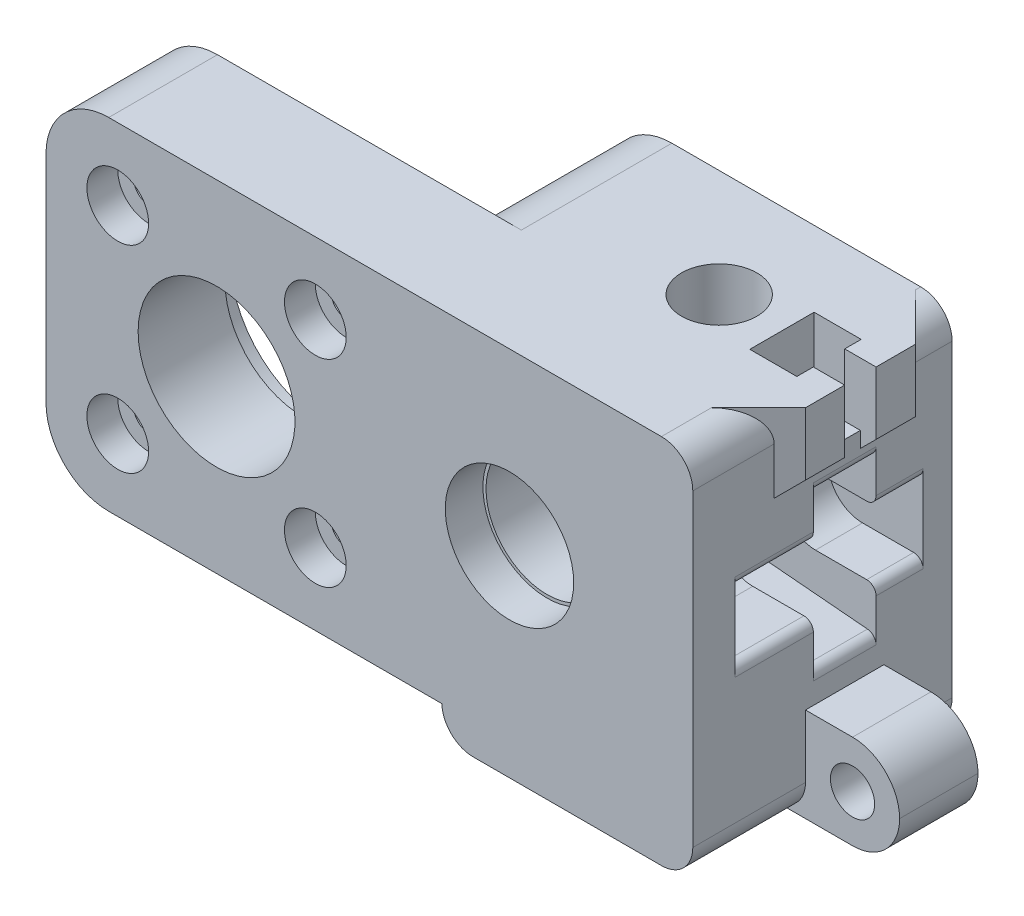
from build123d import *

# Parameters (mm, degrees)
SKETCH5_W               = 50.1536
SKETCH5_H               = 27.62
BOSS_EXTRUDE1_DEPTH     = 21
SKETCH6_R               = 5.2
CUT_EXTRUDE1_DEPTH      = 4
SKETCH7_R               = 4.95
CUT_EXTRUDE2_DEPTH      = 44.456728236
CUT_EXTRUDE3_START      = -3.048
SKETCH8_R               = 5.2
CUT_EXTRUDE3_DEPTH      = 3.048
SKETCH11_W              = 20.32
SKETCH11_H              = 6.1976
BOSS_EXTRUDE2_DEPTH     = 21
CUT_EXTRUDE4_DEPTH      = 52.113946521
CUT_EXTRUDE4_DEPTH_BACK = 52.113946521
SKETCH9_R               = 1.143
CUT_EXTRUDE5_START      = -15.2522
SKETCH12_W              = 13.208
SKETCH12_H              = 2.921
CUT_EXTRUDE5_DEPTH      = 15.2522
SKETCH13_R              = 4.9403
CUT_EXTRUDE6_DEPTH      = 8.89
SKETCH14_R              = 3.048
CUT_EXTRUDE7_DEPTH      = 6.35
CUT_EXTRUDE8_DEPTH      = 12.192
SKETCH16_R              = 7.6778
CUT_EXTRUDE9_DEPTH      = 1.778
SKETCH17_R              = 6.35
CUT_EXTRUDE10_DEPTH     = 44.23068691
SKETCH18_R              = 1.2
CUT_EXTRUDE11_DEPTH     = 43.689299066
SKETCH19_W              = 2.225
SKETCH19_H              = 21
BOSS_EXTRUDE3_DEPTH     = 23.89
SKETCH20_W              = 5.08
SKETCH20_H              = 9.90092
CUT_EXTRUDE12_DEPTH     = 46.986208701
CUT_EXTRUDE13_REACH     = 44.427
SKETCH23_W              = 8.89
SKETCH23_H              = 5.08
BOSS_EXTRUDE4_DEPTH     = 1.27
CUT_EXTRUDE15_DEPTH     = 6.35
CUT_EXTRUDE16_START     = -3.81
CUT_EXTRUDE16_DEPTH     = 3.81
SKETCH27_W              = 6.35
SKETCH27_H              = 7.62
BOSS_EXTRUDE6_DEPTH     = 7.62
CHAMFER1_SIZE           = 1.27
FILLET2_R               = 3.81
SKETCH28_W              = 3.81
SKETCH28_H              = 5.207
CUT_EXTRUDE17_DEPTH     = 5.08
SKETCH29_W              = 2.54
SKETCH29_H              = 5.08
CUT_EXTRUDE18_DEPTH     = 5.08
SKETCH30_R              = 1.7907
CUT_EXTRUDE19_DEPTH     = 43.599568856
SKETCH31_W              = 2.54
SKETCH31_H              = 1.62646495
CUT_EXTRUDE20_DEPTH     = 59.732256893
FILLET3_R               = 0.508
SKETCH32_R              = 2.5
CUT_EXTRUDE21_DEPTH     = 2.5
FILLET4_R               = 5.08
FILLET5_R               = 5.08
FILLET6_R               = 2.54
FILLET7_R               = 2.54
FILLET8_R               = 0.762
FILLET9_R               = 0.762


# Some blends are built 0.0001 mm under size
with BuildPart() as part:
    # Sketch5 → Boss-Extrude1 (new body)
    with BuildSketch(Plane.XY):
        with Locations((-12.4568, 0)):
            Rectangle(SKETCH5_W, SKETCH5_H)
    extrude(amount=BOSS_EXTRUDE1_DEPTH)

    # Sketch6 → Cut-Extrude1 (cut)
    with BuildSketch(Plane(origin=(0, 0, 0), x_dir=(-1, 0, 0), z_dir=(0, 0, -1))):
        Circle(SKETCH6_R)
    extrude(amount=-CUT_EXTRUDE1_DEPTH, mode=Mode.SUBTRACT)

    # Sketch7 → Cut-Extrude2 (cut, through all)
    with BuildSketch(Plane(origin=(0, 0, 4), x_dir=(-1, 0, 0), z_dir=(0, 0, -1))):
        Circle(SKETCH7_R)
    extrude(amount=-CUT_EXTRUDE2_DEPTH, mode=Mode.SUBTRACT)

    # Sketch8 → Cut-Extrude3 (cut)
    with BuildSketch(Plane.XY.offset(21).offset(CUT_EXTRUDE3_START)):
        with Locations(Location((0, 0, 0), (0, 0, 180))):
            Circle(SKETCH8_R)
    extrude(amount=CUT_EXTRUDE3_DEPTH, mode=Mode.SUBTRACT)

    # Sketch11 → Boss-Extrude2 (add)
    with BuildSketch(Plane(origin=(0, 0, 0), x_dir=(-1, 0, 0), z_dir=(0, 0, -1))):
        with Locations((-4.685, -13.1788)):
            Rectangle(SKETCH11_W, SKETCH11_H)
    extrude(amount=-BOSS_EXTRUDE2_DEPTH)

    # Sketch9 → Cut-Extrude4 (cut, two sides: drawn at the far end of the back side and taken through both)
    with BuildSketch(Plane.XZ.offset(13.81).offset(-CUT_EXTRUDE4_DEPTH_BACK)):
        with Locations(Location((4.685, 8.699, 0), (0, 0, 270))):
            Circle(SKETCH9_R)
    extrude(amount=CUT_EXTRUDE4_DEPTH + CUT_EXTRUDE4_DEPTH_BACK, mode=Mode.SUBTRACT)

    # Sketch12 → Cut-Extrude5 (cut)
    with BuildSketch(Plane(origin=(0, 0, 0), x_dir=(-1, 0, 0), z_dir=(0, 0, -1)).offset(CUT_EXTRUDE5_START)):
        with Locations((-4.685, -11.2738)):
            Rectangle(SKETCH12_W, SKETCH12_H)
    extrude(amount=CUT_EXTRUDE5_DEPTH, mode=Mode.SUBTRACT)

    # Sketch13 → Cut-Extrude6 (cut)
    with BuildSketch(Plane.XZ.offset(16.2776)):
        with Locations(Location((4.685, 8.699, 0), (0, 0, 270))):
            Circle(SKETCH13_R)
    extrude(amount=-CUT_EXTRUDE6_DEPTH, mode=Mode.SUBTRACT)

    # Sketch14 → Cut-Extrude7 (cut)
    with BuildSketch(Plane(origin=(0, 13.81, 0), x_dir=(1, 0, 0), z_dir=(0, 1, 0))):
        with Locations(Location((4.685, -8.699, 0), (0, 0, 180))):
            Circle(SKETCH14_R)
    extrude(amount=-CUT_EXTRUDE7_DEPTH, mode=Mode.SUBTRACT)

    # Sketch15 → Cut-Extrude8 (cut)
    with BuildSketch(Plane(origin=(0, 0, 0), x_dir=(-1, 0, 0), z_dir=(0, 0, -1))):
        Polygon((12.9286, 10.795), (12.9286, 13.81), (37.5336, 13.81), (37.5336, -13.81), (12.9286, -13.81), align=None)
    extrude(amount=-CUT_EXTRUDE8_DEPTH, mode=Mode.SUBTRACT)

    # Sketch16 → Cut-Extrude9 (cut)
    with BuildSketch(Plane(origin=(0, 0, 12.192), x_dir=(-1, 0, 0), z_dir=(0, 0, -1))):
        with Locations((23.7236, 0)):
            Circle(SKETCH16_R)
    extrude(amount=-CUT_EXTRUDE9_DEPTH, mode=Mode.SUBTRACT)

    # Sketch17 → Cut-Extrude10 (cut, through all)
    with BuildSketch(Plane(origin=(0, 0, 13.97), x_dir=(-1, 0, 0), z_dir=(0, 0, -1))):
        with Locations((23.7236, 0)):
            Circle(SKETCH17_R)
    extrude(amount=-CUT_EXTRUDE10_DEPTH, mode=Mode.SUBTRACT)

    # Sketch18 → Cut-Extrude11 (cut, through all)
    with BuildSketch(Plane(origin=(0, 0, 12.192), x_dir=(-1, 0, 0), z_dir=(0, 0, -1))):
        with Locations((15.7236, 8)):
            Circle(SKETCH18_R)
        with Locations((31.7236, 8)):
            Circle(SKETCH18_R)
        with Locations((31.7236, -8)):
            Circle(SKETCH18_R)
        with Locations((15.7236, -8)):
            Circle(SKETCH18_R)
    extrude(amount=-CUT_EXTRUDE11_DEPTH, mode=Mode.SUBTRACT)

    # Sketch19 → Boss-Extrude3 (add)
    with BuildSketch(Plane(origin=(0, -10.08, 0), x_dir=(1, 0, 0), z_dir=(0, 1, 0))):
        with Locations((13.7325, -10.5)):
            Rectangle(SKETCH19_W, SKETCH19_H)
    extrude(amount=BOSS_EXTRUDE3_DEPTH)

    # Sketch20 → Cut-Extrude12 (cut, through all)
    with BuildSketch(Plane(origin=(0, 0, 0), x_dir=(0, 0, -1), z_dir=(1, 0, 0))):
        with Locations((-8.699, 0)):
            Rectangle(SKETCH20_W, SKETCH20_H)
    extrude(amount=CUT_EXTRUDE12_DEPTH, mode=Mode.SUBTRACT)

    # Cut-Extrude13: up to this face of the body (flat: up to its plane)
    cut_extrude13_end = Plane(part.part.faces().sort_by_distance((9.310423436, 0, 6.159))[0])
    # Sketch22 → Cut-Extrude13 (cut, up to the picked face)
    with BuildSketch(Plane(origin=(0, 0, 11.239), x_dir=(-1, 0, 0), z_dir=(0, 0, -1)), mode=Mode.PRIVATE) as cut_extrude13_sk1:
        Polygon((0, 4.95046), (-17.421153116, 6.474613403), (-17.421153116, -6.474613403), (0, -4.95046), align=None)
    cut_extrude13_tool1 = split(extrude(cut_extrude13_sk1.sketch, amount=CUT_EXTRUDE13_REACH, mode=Mode.PRIVATE), bisect_by=cut_extrude13_end, keep=Keep.BOTH, mode=Mode.PRIVATE)
    add(cut_extrude13_tool1.solids().sort_by(Axis((9.097919, 0, 11.239), (0, 0, -1)))[0], mode=Mode.SUBTRACT)

    # Sketch23 → Boss-Extrude4 (add)
    with BuildSketch(Plane(origin=(14.845, 0, 0), x_dir=(0, 0, -1), z_dir=(1, 0, 0))):
        with Locations((-8.699, 11.27)):
            Rectangle(SKETCH23_W, SKETCH23_H)
    extrude(amount=BOSS_EXTRUDE4_DEPTH)

    # Sketch25 → Cut-Extrude15 (cut)
    with BuildSketch(Plane.XY.offset(11.239)):
        with BuildLine():
            Line((9.939, 2.754), (16.986034424, 2.754))
            Line((16.986034424, 2.754), (16.986034424, -2.754))
            Line((16.986034424, -2.754), (9.939, -2.754))
            ThreePointArc((9.939, -2.754), (7.185, 0), (9.939, 2.754))
        make_face()
    extrude(amount=CUT_EXTRUDE15_DEPTH, mode=Mode.SUBTRACT)

    # Sketch26 → Cut-Extrude16 (cut)
    with BuildSketch(Plane.XY.offset(6.159).offset(CUT_EXTRUDE16_START)):
        with BuildLine():
            Line((16.986034424, 2.754), (16.986034424, -2.754))
            Line((16.986034424, -2.754), (9.939, -2.754))
            ThreePointArc((9.939, -2.754), (7.185, 0), (9.939, 2.754))
            Line((9.939, 2.754), (16.986034424, 2.754))
        make_face()
    extrude(amount=CUT_EXTRUDE16_DEPTH, mode=Mode.SUBTRACT)

    # Sketch27 → Boss-Extrude6 (add)
    with BuildSketch(Plane(origin=(14.845, 0, 0), x_dir=(0, 0, -1), z_dir=(1, 0, 0))):
        with Locations((-8.699, -12.4676)):
            Rectangle(SKETCH27_W, SKETCH27_H)
    extrude(amount=BOSS_EXTRUDE6_DEPTH)

    # Chamfer1
    chamfer1_edges = [part.edges().sort_by_distance(p)[0] for p in [
        (14.845, 11.27, 13.144),
        (14.845, 11.27, 4.254),
        (14.845, 8.73, 8.699),
    ]]
    chamfer(chamfer1_edges, length=CHAMFER1_SIZE - 0.0001)  # a hair under: the kernel refuses the full size

    # Fillet2
    fillet2_edges = [part.edges().sort_by_distance(p)[0] for p in [
        (22.465, -16.2776, 8.699),
        (22.465, -8.6576, 8.699),
    ]]
    fillet(fillet2_edges, radius=FILLET2_R - 0.0001)  # a hair under: the kernel refuses the full size

    # Sketch28 → Cut-Extrude17 (cut)
    with BuildSketch(Plane(origin=(0, 13.81, 0), x_dir=(1, 0, 0), z_dir=(0, 1, 0))):
        with Locations((11.67, -8.699)):
            Rectangle(SKETCH28_W, SKETCH28_H)
    extrude(amount=-CUT_EXTRUDE17_DEPTH, mode=Mode.SUBTRACT)

    # Sketch29 → Cut-Extrude18 (cut)
    with BuildSketch(Plane.ZY.offset(-13.575)):
        with Locations((8.699, 11.27)):
            Rectangle(SKETCH29_W, SKETCH29_H)
    extrude(amount=-CUT_EXTRUDE18_DEPTH, mode=Mode.SUBTRACT)

    # Sketch30 → Cut-Extrude19 (cut, through all)
    with BuildSketch(Plane.XY.offset(11.874)):
        with Locations((18.655, -12.4676)):
            Circle(SKETCH30_R)
    extrude(amount=-CUT_EXTRUDE19_DEPTH, mode=Mode.SUBTRACT)

    # Sketch31 → Cut-Extrude20 (cut, through all)
    with BuildSketch(Plane(origin=(14.845, 0, 0), x_dir=(0, 0, -1), z_dir=(1, 0, 0))):
        with Locations((-8.699, 7.916767525)):
            Rectangle(SKETCH31_W, SKETCH31_H)
    extrude(amount=CUT_EXTRUDE20_DEPTH, mode=Mode.SUBTRACT)

    # Fillet3
    fillet3_edges = [part.edges().sort_by_distance(p)[0] for p in [
        (4.685, 7.46, 9.842),
    ]]
    fillet(fillet3_edges, radius=FILLET3_R)

    # Sketch32 → Cut-Extrude21 (cut)
    with BuildSketch(Plane.XY.offset(21)):
        with Locations((-15.7236, 8)):
            Circle(SKETCH32_R)
        with Locations((-31.7236, 8)):
            Circle(SKETCH32_R)
        with Locations((-31.7236, -8)):
            Circle(SKETCH32_R)
        with Locations((-15.7236, -8)):
            Circle(SKETCH32_R)
    extrude(amount=-CUT_EXTRUDE21_DEPTH, mode=Mode.SUBTRACT)

    # Fillet4
    fillet4_edges = [part.edges().sort_by_distance(p)[0] for p in [
        (-37.5336, -13.81, 16.596),
        (-37.5336, 13.81, 16.596),
    ]]
    fillet(fillet4_edges, radius=FILLET4_R)

    # Fillet5
    fillet5_edges = [part.edges().sort_by_distance(p)[0] for p in [
        (-12.9286, -13.81, 6.096),
        (-12.9286, 13.81, 6.096),
    ]]
    fillet(fillet5_edges, radius=FILLET5_R)

    # Fillet6
    fillet6_edges = [part.edges().sort_by_distance(p)[0] for p in [
        (14.845, 13.81, 1.49205),
        (14.845, -16.2776, 2.762),
        (14.845, 13.81, 17.70695),
        (14.845, -16.2776, 16.437),
    ]]
    fillet(fillet6_edges, radius=FILLET6_R)

    # Fillet7
    # the kernel refuses this fillet: 2.54 mm, written as the material it takes off along each edge
    with BuildSketch(Plane(origin=(-5.475, -16.2776, -6.34741987), x_dir=(1, 0, 0), z_dir=(0, 0, 1))) as fillet7_piece_1:
        with BuildLine():
            CenterArc((2.538967948, 2.54), FILLET7_R, 181.63337652, 88.36662348)
            Line((0, 2.4676), (-0.050779359, 2.466152))
            ThreePointArc((-0.050779359, 2.466152), (-0.0508, 1.2338), (-0.0508, 0))
            Line((-0.0508, 0), (0, -0.0508))
            Line((0, -0.0508), (2.538967948, -0.0508))
            Line((2.538967948, -0.0508), (2.538967948, 0))
        make_face()
    extrude(amount=33.694839739, mode=Mode.SUBTRACT)

    # Fillet8
    fillet8_edges = [part.edges().sort_by_distance(p)[0] for p in [
        (14.845, 6.24922921, 8.699),
        (14.845, -6.24922921, 8.699),
    ]]
    fillet(fillet8_edges, radius=FILLET8_R)

    # Fillet9
    fillet9_edges = [part.edges().sort_by_distance(p)[0] for p in [
        (14.845, -2.754, 14.414),
        (14.845, 2.754, 14.414),
        (14.845, 2.754, 4.254),
        (14.845, -2.754, 4.254),
    ]]
    fillet(fillet9_edges, radius=FILLET9_R)


solid = part.part
